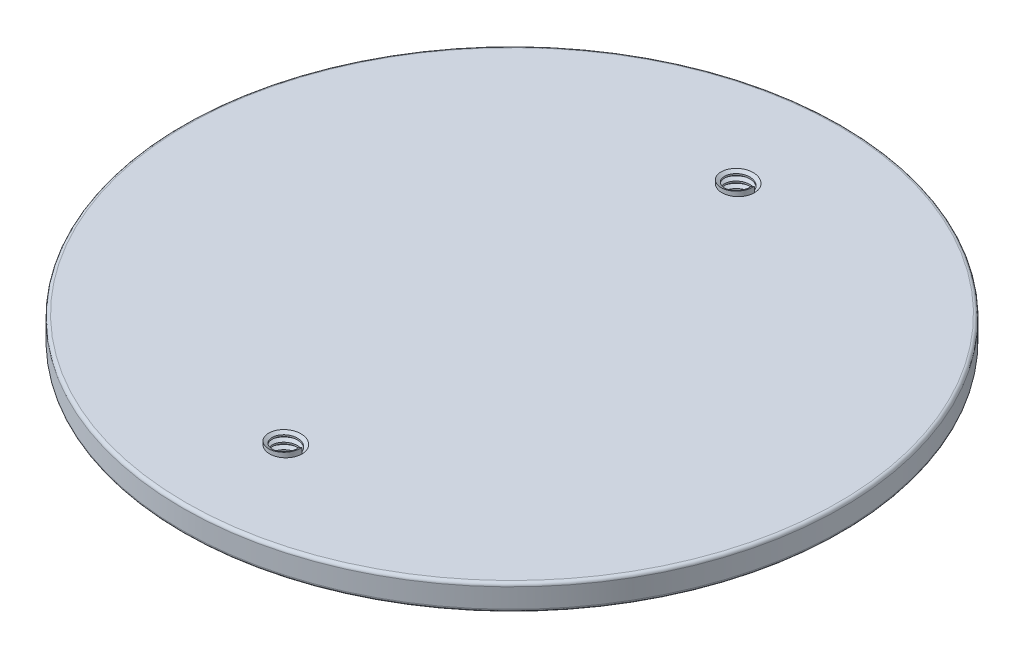
from build123d import *

# Parameters (mm, degrees)
SKETCH2_R           = 64.77
BOSS_EXTRUDE1_DEPTH = 5.08
SKETCH3_R           = 3.175
CUT_EXTRUDE1_DEPTH  = 92.739371046
FILLET1_R           = 0.635
THREAD1_PITCH       = 1.27
THREAD2_PITCH       = 1.27


with BuildPart() as part:
    # Sketch2 → Boss-Extrude1 (new body)
    with BuildSketch(Plane(origin=(0, 0, 0), x_dir=(1, 0, 0), z_dir=(0, 1, 0))):
        with Locations(Location((0, 0, 0), (0, 0, 270))):
            Circle(SKETCH2_R)
    extrude(amount=BOSS_EXTRUDE1_DEPTH)

    # Sketch3 → Cut-Extrude1 (cut, through all)
    with BuildSketch(Plane(origin=(0, 5.08, 0), x_dir=(1, 0, 0), z_dir=(0, 1, 0))):
        with Locations(Location((0, 44.45, 0), (0, 0, 270))):
            Circle(SKETCH3_R)
        with Locations(Location((0, -44.45, 0), (0, 0, 90))):
            Circle(SKETCH3_R)
    extrude(amount=-CUT_EXTRUDE1_DEPTH, mode=Mode.SUBTRACT)

    # Fillet1
    fillet1_edges = [part.edges().sort_by_distance(p)[0] for p in [
        (0, 0, -64.77),
        (0, 5.08, -64.77),
    ]]
    fillet(fillet1_edges, radius=FILLET1_R)

    # Thread1: the profile of Thread Profile2 profile screwed along a right-hand helix of 4 turns, 8 arcs to a turn; built about Z, then put on its axis
    thread1_z = Axis((0, 0, 0), (0, 0, 1))
    thread1_corners = [(3.1753, 0, -0.000173205), (3.1753, 0, 1.111423202), (2.487592339, 0, 0.714374998), (2.487592339, 0, 0.396874998)]
    with BuildLine(mode=Mode.PRIVATE) as thread1_profile:
        Line(thread1_corners[0], thread1_corners[1])
        Line(thread1_corners[1], thread1_corners[2])
        Line(thread1_corners[2], thread1_corners[3])
        Line(thread1_corners[3], thread1_corners[0])
    thread1_cap = Face(thread1_profile.wire())
    thread1_turn_angles = [0, 22.5, 45, 67.5, 90, 112.5, 135, 157.5, 180, 202.5, 225, 247.5, 270, 292.5, 315, 337.5, 360]
    thread1_turn_weights = [1, 0.9238795325112867, 1, 0.9238795325112867, 1, 0.9238795325112867, 1, 0.9238795325112867, 1, 0.9238795325112867, 1, 0.9238795325112867, 1, 0.9238795325112867, 1, 0.9238795325112867, 1]
    thread1_turn_rails = [Edge.make_bspline([Vector(p[0], p[1], 0).rotate(thread1_z, thread1_turn_angles[k]) / thread1_turn_weights[k] + Vector(0, 0, p[2] + THREAD1_PITCH * thread1_turn_angles[k] / 360) for k in range(17)], [0, 0, 0, 1, 1, 2, 2, 3, 3, 4, 4, 5, 5, 6, 6, 7, 7, 8, 8, 8], 2, thread1_turn_weights) for p in thread1_corners]
    thread1_turn_sides = [Face.make_surface_from_curves(thread1_turn_rails[p[0]], thread1_turn_rails[p[1]]) for p in [(0, 1), (1, 2), (2, 3), (3, 0)]]
    thread1 = Plane(origin=(0, 0, 44.45), x_dir=(1, 0, 0), z_dir=(0, 1, 0)) * Solid(Shell([*[p.moved(Location((0, 0, THREAD1_PITCH * i))) for i in range(4) for p in thread1_turn_sides], thread1_cap, thread1_cap.rotate(thread1_z, 1440).moved(Location((0, 0, THREAD1_PITCH * 1440 / 360)))]))
    add(thread1)

    # Thread2: the profile of Thread Profile3 profile screwed along a right-hand helix of 4 turns, 8 arcs to a turn; built about Z, then put on its axis
    thread2_z = Axis((0, 0, 0), (0, 0, 1))
    thread2_corners = [(3.1753, 0, -0.000173205), (3.1753, 0, 1.111423202), (2.487592339, 0, 0.714374998), (2.487592339, 0, 0.396874998)]
    with BuildLine(mode=Mode.PRIVATE) as thread2_profile:
        Line(thread2_corners[0], thread2_corners[1])
        Line(thread2_corners[1], thread2_corners[2])
        Line(thread2_corners[2], thread2_corners[3])
        Line(thread2_corners[3], thread2_corners[0])
    thread2_cap = Face(thread2_profile.wire())
    thread2_turn_angles = [0, 22.5, 45, 67.5, 90, 112.5, 135, 157.5, 180, 202.5, 225, 247.5, 270, 292.5, 315, 337.5, 360]
    thread2_turn_weights = [1, 0.9238795325112867, 1, 0.9238795325112867, 1, 0.9238795325112867, 1, 0.9238795325112867, 1, 0.9238795325112867, 1, 0.9238795325112867, 1, 0.9238795325112867, 1, 0.9238795325112867, 1]
    thread2_turn_rails = [Edge.make_bspline([Vector(p[0], p[1], 0).rotate(thread2_z, thread2_turn_angles[k]) / thread2_turn_weights[k] + Vector(0, 0, p[2] + THREAD2_PITCH * thread2_turn_angles[k] / 360) for k in range(17)], [0, 0, 0, 1, 1, 2, 2, 3, 3, 4, 4, 5, 5, 6, 6, 7, 7, 8, 8, 8], 2, thread2_turn_weights) for p in thread2_corners]
    thread2_turn_sides = [Face.make_surface_from_curves(thread2_turn_rails[p[0]], thread2_turn_rails[p[1]]) for p in [(0, 1), (1, 2), (2, 3), (3, 0)]]
    thread2 = Plane(origin=(0, 0, -44.45), x_dir=(1, 0, 0), z_dir=(0, 1, 0)) * Solid(Shell([*[p.moved(Location((0, 0, THREAD2_PITCH * i))) for i in range(4) for p in thread2_turn_sides], thread2_cap, thread2_cap.rotate(thread2_z, 1440).moved(Location((0, 0, THREAD2_PITCH * 1440 / 360)))]))
    add(thread2)


solid = part.part
